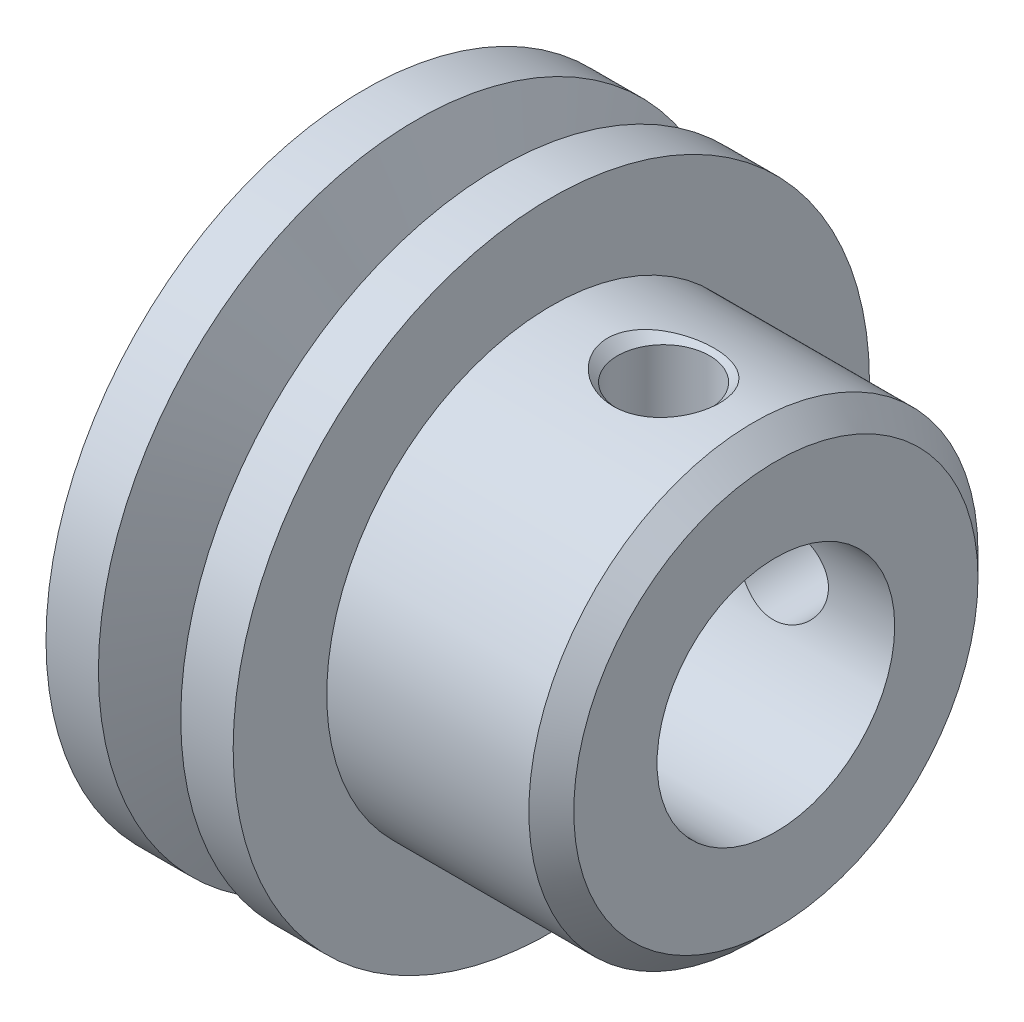
from build123d import *

# Parameters (mm, degrees)
SKETCH2_R           = 6
BOSS_EXTRUDE1_DEPTH = 6
HOLE1_D             = 6.35
CHAMFER1_SIZE       = 0.6


# Read off the part's stored shape, not the designer's step: CSK for M2 Flat Head Machine Screw1, CSK for M2 Flat Head Machine Screw2
with BuildPart() as part:
    # Sketch1 → Revolve1 (revolve)
    with BuildSketch(Plane(origin=(0, 0, 0), x_dir=(-1, 0, 0), z_dir=(0, 0, -1)), mode=Mode.PRIVATE) as revolve1_sk:
        Polygon((-2.5, 8.5), (-2.5, 0), (2.5, 0), (2.5, 8.5), (1.1, 8.5), (0.271572875, 6.5), (-0.271572875, 6.5), (-1.1, 8.5), align=None)
    revolve(revolve1_sk.sketch.rotate(Axis((2.5, 0, 0), (-1, 0, 0)), 270), axis=Axis((2.5, 0, 0), (-1, 0, 0)))

    # Sketch2 → Boss-Extrude1 (add)
    with BuildSketch(Plane(origin=(2.5, 0, 0), x_dir=(0, 0, -1), z_dir=(1, 0, 0))):
        Circle(SKETCH2_R)
    extrude(amount=BOSS_EXTRUDE1_DEPTH)

    # Hole1 (through all)
    with Locations(Plane(origin=(8.5, 0, 0), x_dir=(0, 0, -1), z_dir=(1, 0, 0))):
        with Locations((0, 0)):
            Hole(HOLE1_D / 2)

    # CSK for M2 Flat Head Machine Screw1 outl → CSK for M2 Flat Head Machine Screw1 (revolve, cut)
    with BuildSketch(Plane(origin=(5.5, 0, 0), x_dir=(1, 0, 0), z_dir=(0, -1, 0))):
        Polygon((0, -6.000000161), (1.500000161, -6.000000161), (1.2295, -5.7295), (1.2295, -2.927170217), (0, -2.927170217), align=None)
    revolve(axis=Axis((5.5, 0, 0), (0, 0, 1)), mode=Mode.SUBTRACT)

    # CSK for M2 Flat Head Machine Screw2 outl → CSK for M2 Flat Head Machine Screw2 (revolve, cut)
    with BuildSketch(Plane(origin=(5.5, 0, 0), x_dir=(1, 0, 0), z_dir=(0, 0, 1))):
        Polygon((1.500065457, 6.000065457), (0, 6.000065457), (0, 2.927130581), (1.2295, 2.927130581), (1.2295, 5.7295), align=None)
    revolve(axis=Axis((5.5, 0, 0), (0, 1, 0)), mode=Mode.SUBTRACT)

    # Chamfer1
    chamfer1_edges = [part.edges().sort_by_distance(p)[0] for p in [
        (8.5, 0, 6),
    ]]
    chamfer(chamfer1_edges, length=CHAMFER1_SIZE)


solid = part.part
